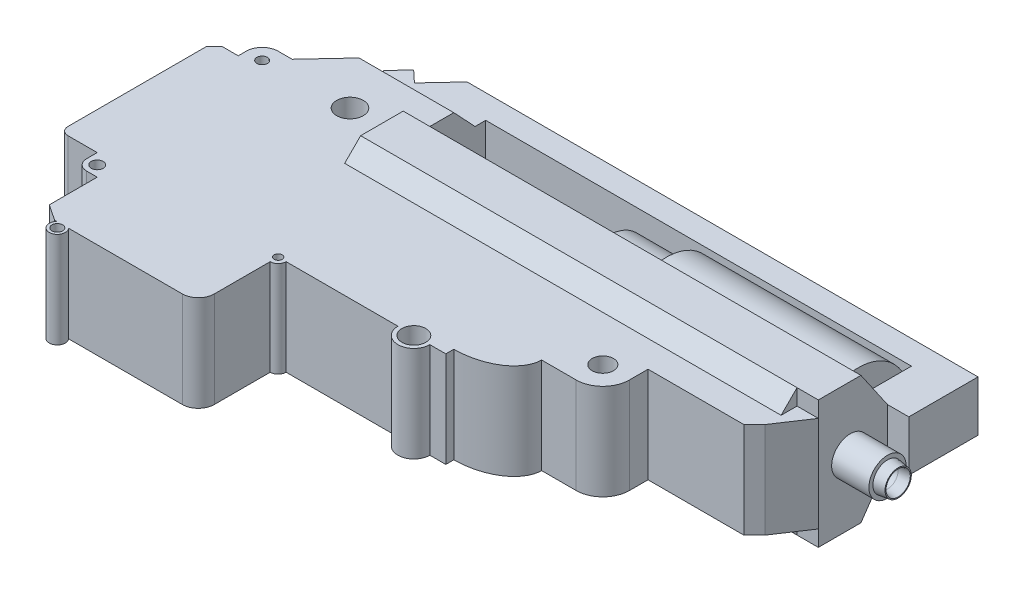
from build123d import *

# Parameters (mm, degrees)
SALIENTE_EXTRUIR1_DEPTH    = 9.5
SALIENTE_EXTRUIR1_2_DEPTH  = 9.5
CROQUIS2_R                 = 9.5
SALIENTE_EXTRUIR2_DEPTH    = 36
CROQUIS3_R                 = 7.5
SALIENTE_EXTRUIR3_DEPTH    = 11
CROQUIS5_R                 = 3.5
SALIENTE_EXTRUIR4_DEPTH    = 33
SALIENTE_EXTRUIR5_DEPTH    = 4
CROQUIS7_R                 = 3.5
CROQUIS7_R_2               = 2
SALIENTE_EXTRUIR6_DEPTH    = 7
CROQUIS8_R                 = 2.75
CROQUIS8_R_2               = 2
SALIENTE_EXTRUIR7_DEPTH    = 2
SALIENTE_EXTRUIR7_DRAFT    = 8
SALIENTE_EXTRUIR8_DEPTH    = 23
CORTAR_EXTRUIR3_DEPTH      = 40
CORTAR_EXTRUIR3_DEPTH_BACK = 34
SALIENTE_EXTRUIR10_DEPTH   = 82
CROQUIS19_R                = 1
SALIENTE_EXTRUIR11_DEPTH   = 18
CROQUIS20_R                = 2.5
CORTAR_EXTRUIR4_DEPTH      = 18
CROQUIS21_R                = 0.999067224
CROQUIS21_R_2              = 1.124597049
CROQUIS21_R_3              = 0.75
CROQUIS21_R_4              = 2.25
CROQUIS21_R_5              = 2
SALIENTE_EXTRUIR19_DEPTH   = 18
SALIENTE_EXTRUIR20_DEPTH   = 9.5


with BuildPart() as part:
    # Croquis1 → Saliente-Extruir1 (new body)
    with BuildSketch(Plane(origin=(0, 0, 0), x_dir=(1, 0, 0), z_dir=(0, 1, 0))):
        Polygon((96, 0), (0, 0), (-4.270726999, -4.575778927), (-7.194948072, -1.846505926), (-9.924221073, -4.770726999), (-7, -7.5), (8, -7.5), (8, -4.5), (88, -4.5), (88, -13), (96, -13), align=None)
    extrude(amount=SALIENTE_EXTRUIR1_DEPTH)

    # Croquis2 → Saliente-Extruir2 (add)
    with BuildSketch(Plane.ZY.offset(-88)):
        with Locations((14.5, 4.75)):
            Circle(CROQUIS2_R)
    extrude(amount=SALIENTE_EXTRUIR2_DEPTH)

    # Croquis3 → Saliente-Extruir3 (add)
    with BuildSketch(Plane.ZY.offset(-52)):
        with Locations((14.5, 4.75)):
            Circle(CROQUIS3_R)
    extrude(amount=SALIENTE_EXTRUIR3_DEPTH)

    # Croquis5 → Saliente-Extruir4 (add)
    with BuildSketch(Plane.ZY.offset(-41)):
        with Locations((14.5, 4.75)):
            Circle(CROQUIS5_R)
    extrude(amount=SALIENTE_EXTRUIR4_DEPTH)

    # Croquis6 → Saliente-Extruir5 (add)
    with BuildSketch(Plane(origin=(88, 0, 0), x_dir=(0, 0, -1), z_dir=(1, 0, 0))):
        Polygon((-26, -7.25), (-26, 16.75), (-18, 16.75), (-13, 9.5), (-13, 0), (-18, -7.25), align=None)
    extrude(amount=SALIENTE_EXTRUIR5_DEPTH)

    # Croquis7 → Saliente-Extruir6 (add)
    with BuildSketch(Plane(origin=(92, 0, 0), x_dir=(0, 0, -1), z_dir=(1, 0, 0))):
        with Locations((-20, 4.75)):
            Circle(CROQUIS7_R)
        with Locations((-20, 4.75)):
            Circle(CROQUIS7_R_2, mode=Mode.SUBTRACT)
    extrude(amount=SALIENTE_EXTRUIR6_DEPTH)


with BuildPart() as body_2:
    # Croquis1 → Saliente-Extruir1 2 (new body)
    with BuildSketch(Plane(origin=(0, 0, 0), x_dir=(1, 0, 0), z_dir=(0, 1, 0))):
        Polygon((-10.411591252, -11.155276341), (-13.335812325, -8.42600334), (-16.065085326, -11.350224413), (-13.140864253, -14.079497414), align=None)
    extrude(amount=SALIENTE_EXTRUIR1_2_DEPTH)


with BuildPart() as saliente_extruir7_tool:
    # Croquis8 → Saliente-Extruir7 (with draft: the straight prism first)
    with BuildSketch(Plane(origin=(99, 0, 0), x_dir=(0, 0, -1), z_dir=(1, 0, 0))):
        with Locations((-20, 4.75)):
            Circle(CROQUIS8_R)
        with Locations((-20, 4.75)):
            Circle(CROQUIS8_R_2, mode=Mode.SUBTRACT)
    extrude(amount=SALIENTE_EXTRUIR7_DEPTH)
    # Saliente-Extruir7: the draft: its side faces are tilted about the plane it starts from
    saliente_extruir7_sides = [saliente_extruir7_tool.faces().sort_by_distance(p)[0] for p in [
        (100, 4.75, 22.75),
        (100, 4.75, 22),
    ]]
    draft(saliente_extruir7_sides, Plane(origin=(99, 0, 0), x_dir=(0, 0, -1), z_dir=(1, 0, 0)), SALIENTE_EXTRUIR7_DRAFT)


with BuildPart() as part_1:
    add(part.part)

    # Saliente-Extruir7: add saliente_extruir7_tool
    add(saliente_extruir7_tool.part)


    add(body_2.part)  # Saliente-Extruir8 merges body 2
    # Croquis9 → Saliente-Extruir8 (add)
    with BuildSketch(Plane.ZY.offset(-8)):
        Polygon((6.5, 9.5), (10.5, 13.75), (17.5, 13.75), (17.5, -4.25), (10.5, -4.25), (6.5, 0), (4.5, 0), (4.5, 9.5), align=None)
    extrude(amount=SALIENTE_EXTRUIR8_DEPTH)

    # Croquis17 → Cortar-Extruir3 (cut, two sides: drawn at the far end of the back side and taken through both)
    with BuildSketch(Plane(origin=(0, 13.75, 0), x_dir=(1, 0, 0), z_dir=(0, 1, 0)).offset(-CORTAR_EXTRUIR3_DEPTH_BACK)):
        Polygon((0, 0), (-16.8, 0), (-16.8, -18), align=None)
    extrude(amount=CORTAR_EXTRUIR3_DEPTH + CORTAR_EXTRUIR3_DEPTH_BACK, mode=Mode.SUBTRACT)

    # Croquis18 → Saliente-Extruir10 (add)
    with BuildSketch(Plane.ZY.offset(-88)):
        Polygon((18, -7.25), (26, -7.25), (29, -4.25), (26, -4.25), (18, -4.25), align=None)
        Polygon((26, 16.75), (18, 16.75), (18, 13.75), (26, 13.75), (29, 13.75), align=None)
    extrude(amount=SALIENTE_EXTRUIR10_DEPTH)

    # Croquis19 → Saliente-Extruir11 (add)
    with BuildSketch(Plane(origin=(0, 13.75, 0), x_dir=(1, 0, 0), z_dir=(0, 1, 0))):
        with BuildLine():
            Line((8, -24.5), (8, -17.5))
            Line((8, -17.5), (-15, -17.5))
            Line((-15, -17.5), (-15, -16.071428571))
            Line((-15, -16.071428571), (-15.866666667, -17))
            Line((-15.866666667, -17), (-16.866666667, -17))
            Line((-16.866666667, -17), (-18.5, -17))
            ThreePointArc((-18.5, -17), (-20.621320344, -17.878679656), (-21.5, -20))
            Line((-21.5, -20), (-21.5, -21.5))
            Line((-21.5, -21.5), (-24.5, -21.5))
            Line((-24.5, -21.5), (-26, -23))
            Line((-26, -23), (-26, -24.5))
            Line((-26, -24.5), (8, -24.5))
        make_face()
        with Locations((-18.5, -20)):
            Circle(CROQUIS19_R, mode=Mode.SUBTRACT)
    extrude(amount=-SALIENTE_EXTRUIR11_DEPTH)

    # Croquis20 → Cortar-Extruir4 (cut)
    with BuildSketch(Plane(origin=(0, 13.75, 0), x_dir=(1, 0, 0), z_dir=(0, 1, 0))):
        with Locations((-2.5, -19.5)):
            Circle(CROQUIS20_R)
    extrude(amount=-CORTAR_EXTRUIR4_DEPTH, mode=Mode.SUBTRACT)

    # Croquis21 → Saliente-Extruir19 (add)
    with BuildSketch(Plane(origin=(0, 13.75, 0), x_dir=(1, 0, 0), z_dir=(0, 1, 0))):
        with BuildLine():
            Line((6, -24.5), (-26, -24.5))
            Line((-26, -24.5), (-26, -49))
            ThreePointArc((-26, -49), (-25.560660172, -50.060660172), (-24.5, -50.5))
            Line((-24.5, -50.5), (-19, -50.5))
            Line((-19, -50.5), (-19, -52.5))
            ThreePointArc((-19, -52.5), (-18.414213562, -53.914213562), (-17, -54.5))
            Line((-17, -54.5), (-15, -54.5))
            Line((-15, -54.5), (-15, -63.5))
            Line((-15, -63.5), (-12, -65.5))
            Line((-12, -65.5), (-11.618033989, -65.5))
            ThreePointArc((-11.618033989, -65.5), (-10.5, -68), (-9.381966011, -65.5))
            Line((-9.381966011, -65.5), (12, -65.5))
            ThreePointArc((12, -65.5), (14.121320344, -64.621320344), (15, -62.5))
            Line((15, -62.5), (15, -52))
            ThreePointArc((15, -52), (16.060660172, -51.560660172), (16.5, -50.5))
            Line((16.5, -50.5), (37.5, -50.5))
            ThreePointArc((37.5, -50.5), (40.5, -53.5), (43.5, -50.5))
            Line((43.5, -50.5), (46.5, -50.5))
            Line((46.5, -50.5), (46.5, -49))
            add(Edge.make_bspline(
                [(46.5, -49), (56.5, -49), (56.5, -42.5)],
                knots=[4.71238898, 4.71238898, 4.71238898, 6.283185307, 6.283185307, 6.283185307], degree=2, weights=[1, 0.707106781, 1]))
            Line((56.5, -42.5), (63, -42.5))
            ThreePointArc((63, -42.5), (66.535533906, -41.035533906), (68, -37.5))
            Line((68, -37.5), (68, -34))
            Line((68, -34), (86, -34))
            Line((86, -34), (88, -32))
            Line((88, -32), (92, -26))
            Line((92, -26), (92, -24.5))
            Line((92, -24.5), (6, -24.5))
        make_face()
        with Locations((-10.5, -66.5)):
            Circle(CROQUIS21_R, mode=Mode.SUBTRACT)
        with Locations((-17, -52.5)):
            Circle(CROQUIS21_R_2, mode=Mode.SUBTRACT)
        with Locations((15, -50.5)):
            Circle(CROQUIS21_R_3, mode=Mode.SUBTRACT)
        with Locations((40.5, -50.5)):
            Circle(CROQUIS21_R_4, mode=Mode.SUBTRACT)
        with Locations((63, -37.5)):
            Circle(CROQUIS21_R_5, mode=Mode.SUBTRACT)
    extrude(amount=-SALIENTE_EXTRUIR19_DEPTH)

    # Croquis22 → Saliente-Extruir20 (add)
    with BuildSketch(Plane(origin=(0, 9.5, 0), x_dir=(1, 0, 0), z_dir=(0, 1, 0))):
        Polygon((-4.776227753, -5.117386878), (-6.969393557, -3.070432127), (-9.698666559, -5.9946532), (-7.505500754, -8.041607951), align=None)
        Polygon((-10.234773755, -10.965829024), (-12.42793956, -8.918874273), (-15.157212562, -11.843095346), (-12.964046757, -13.890050097), align=None)
    extrude(amount=-SALIENTE_EXTRUIR20_DEPTH)


solid = part_1.part
